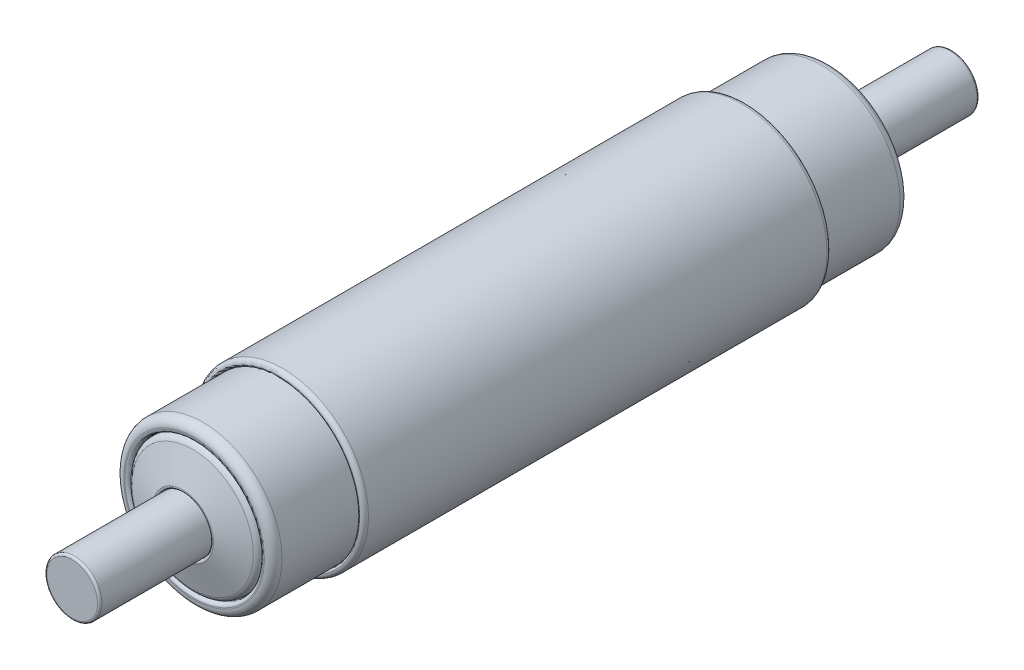
from build123d import *

# Parameters (mm, degrees)
SKETCH3_W   = 53.975
SKETCH3_H   = 0.762
SKETCH3_W_2 = 101.6
SKETCH3_H_2 = 3.175
FILLET1_R   = 0.508
SKETCH4_W   = 73.445045302
SKETCH4_H   = 1.524
FILLET2_R   = 0.762
FILLET3_R   = 1.016
FILLET4_R   = 0.254
FILLET5_R   = 0.381
FILLET6_R   = 0.254
FILLET7_R   = 0.254


with BuildPart() as part:
    # Sketch3 → Revolve1 (revolve)
    with BuildSketch(Plane(origin=(0, 0, 0), x_dir=(0, 0, -1), z_dir=(1, 0, 0)), mode=Mode.PRIVATE) as revolve1_sk:
        with Locations((0, 9.525)):
            Rectangle(SKETCH3_W, SKETCH3_H)
        with Locations((0, 1.5875)):
            Rectangle(SKETCH3_W_2, SKETCH3_H_2)
    revolve(revolve1_sk.sketch.rotate(Axis((0, 0, 50.8), (0, 0, -1)), 90), axis=Axis((0, 0, 50.8), (0, 0, -1)))

    # Fillet1
    fillet1_edges = [part.edges().sort_by_distance(p)[0] for p in [
        (-9.906, 0, 26.9875),
        (-9.906, 0, -26.9875),
    ]]
    fillet(fillet1_edges, radius=FILLET1_R)

    # Fillet6
    fillet6_edges = [part.edges().sort_by_distance(p)[0] for p in [
        (-3.175, 0, 50.8),
        (-3.175, 0, -50.8),
    ]]
    fillet(fillet6_edges, radius=FILLET6_R)

    # Fillet7
    fillet7_edges = [part.edges().sort_by_distance(p)[0] for p in [
        (-9.144, 0, -26.9875),
        (-9.144, 0, 26.9875),
    ]]
    fillet(fillet7_edges, radius=FILLET7_R - 0.0001)  # a hair under: the kernel refuses the full size


with BuildPart() as body_2:
    # Sketch4 → Revolve2 (revolve)
    with BuildSketch(Plane(origin=(0, 0, 0), x_dir=(0, 0, -1), z_dir=(1, 0, 0)), mode=Mode.PRIVATE) as revolve2_sk:
        with Locations((0, 8.382)):
            Rectangle(SKETCH4_W, SKETCH4_H)
        Polygon((-38.1, 3.175), (38.1, 3.175), (36.722522651, 7.5438), (-36.722522651, 7.5438), align=None)
    revolve(revolve2_sk.sketch.rotate(Axis((0, 0, 50.8), (0, 0, -1)), 180), axis=Axis((0, 0, 50.8), (0, 0, -1)))

    # Fillet2
    fillet2_edges = [body_2.edges().sort_by_distance(p)[0] for p in [
        (0, 7.5438, -36.722522651),
        (0, 7.5438, 36.722522651),
    ]]
    fillet(fillet2_edges, radius=FILLET2_R)

    # Fillet3
    fillet3_edges = [body_2.edges().sort_by_distance(p)[0] for p in [
        (0, 9.144, 36.722522651),
        (0, 9.144, -36.722522651),
    ]]
    fillet(fillet3_edges, radius=FILLET3_R)

    # Fillet4
    fillet4_edges = [body_2.edges().sort_by_distance(p)[0] for p in [
        (0, 3.175, 38.1),
        (0, 3.175, -38.1),
    ]]
    fillet(fillet4_edges, radius=FILLET4_R)

    # Fillet5
    fillet5_edges = [body_2.edges().sort_by_distance(p)[0] for p in [
        (0, 7.62, -36.722522651),
        (0, 7.62, 36.722522651),
    ]]
    fillet(fillet5_edges, radius=FILLET5_R)


solid = Compound([part.part, body_2.part])
